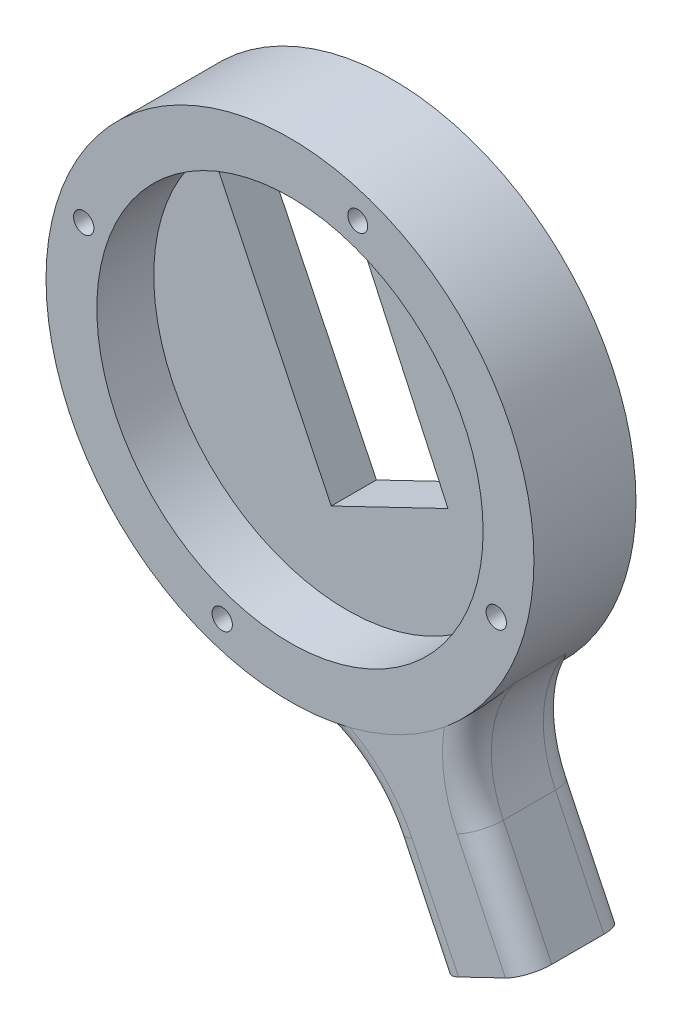
from build123d import *

# Parameters (mm, degrees)
SKETCH1_R                = 60
BOSS_EXTRUDE1_DEPTH      = 25.1
SKETCH3_R                = 47.5
CUT_EXTRUDE2_DEPTH       = 14
CUT_EXTRUDE5_DEPTH       = 89.487343728
CUT_EXTRUDE5_DEPTH_BACK  = 89.487343728
SKETCH2_R                = 2.494998654
SKETCH2_R_2              = 2.5
SKETCH2_R_3              = 2.444443829
SKETCH6_R                = 3
CUT_EXTRUDE6_DEPTH       = 6
CUT_EXTRUDE7_DEPTH       = 87
CUT_EXTRUDE7_DEPTH_BACK  = 87
BOSS_EXTRUDE2_DEPTH      = 30
BOSS_EXTRUDE2_DEPTH_BACK = 23
SKETCH8_W                = 24.8
SKETCH8_H                = 24.8
FILLET1_R                = 30
SKETCH9_R                = 6.1
CUT_EXTRUDE8_DEPTH       = 40
FILLET2_R                = 6


with BuildPart() as part:
    # Sketch1 → Boss-Extrude1 (new body)
    with BuildSketch(Plane.XY):
        Circle(SKETCH1_R)
    extrude(amount=BOSS_EXTRUDE1_DEPTH)

    # Sketch3 → Cut-Extrude2 (cut)
    with BuildSketch(Plane.XY.offset(25.1)):
        Circle(SKETCH3_R)
    extrude(amount=-CUT_EXTRUDE2_DEPTH, mode=Mode.SUBTRACT)

    # Sketch2 → Cut-Extrude5 (cut, two sides: drawn at the far end of the back side and taken through both)
    with BuildSketch(Plane.XY.offset(25.1).offset(-CUT_EXTRUDE5_DEPTH_BACK)):
        with Locations((-16.664697145, -50.733104448)):
            Circle(SKETCH2_R)
        with Locations((-50.733105114, 16.664696544)):
            Circle(SKETCH2_R_2)
        with Locations((16.664695878, 50.733104512)):
            Circle(SKETCH2_R_3)
        with Locations((50.733103846, -16.66469648)):
            Circle(SKETCH2_R_2)
    extrude(amount=CUT_EXTRUDE5_DEPTH + CUT_EXTRUDE5_DEPTH_BACK, mode=Mode.SUBTRACT)

    # Sketch6 → Cut-Extrude6 (cut)
    with BuildSketch(Plane(origin=(0, 0, 0), x_dir=(-1, 0, 0), z_dir=(0, 0, -1))):
        with Locations((11.973502988, 47.212610548)):
            Circle(SKETCH6_R)
        with Locations((27.381285989, 40.029281029)):
            Circle(SKETCH6_R)
        with Locations((-19.717656658, -20.762902692)):
            Circle(SKETCH6_R)
        with Locations((-4.309873657, -27.946232212)):
            Circle(SKETCH6_R)
    extrude(amount=-CUT_EXTRUDE6_DEPTH, mode=Mode.SUBTRACT)

    # Sketch7 → Cut-Extrude7 (cut, two sides: drawn at the far end of the back side and taken through both)
    with BuildSketch(Plane.XY.offset(11.1).offset(-CUT_EXTRUDE7_DEPTH_BACK)):
        Polygon((-32.722381774, 32.714358343), (-3.845549598, -27.273283804), (24.859322702, -13.455341469), (-3.0425496, 47.001626555), align=None)
    extrude(amount=CUT_EXTRUDE7_DEPTH + CUT_EXTRUDE7_DEPTH_BACK, mode=Mode.SUBTRACT)

    # Sketch8 → Boss-Extrude2 (add, two sides: drawn at the far end of the back side and taken through both)
    with BuildSketch(Plane(origin=(33.107502317, -68.776276749, 0), x_dir=(-0.9010375187182339, -0.43374115537044483, 0), z_dir=(0.43374115537044483, -0.9010375187182339, 0)).offset(-BOSS_EXTRUDE2_DEPTH_BACK)):
        with Locations((-0.981202476, -12.478185074)):
            Rectangle(SKETCH8_W, SKETCH8_H)
    extrude(amount=BOSS_EXTRUDE2_DEPTH + BOSS_EXTRUDE2_DEPTH_BACK)

    # Fillet1
    fillet1_edges = [part.edges().sort_by_distance(p)[0] for p in [
        (15.260065741, -58.026979876, 12.478185074),
        (37.425978865, -46.896653463, 12.478185074),
    ]]
    fillet(fillet1_edges, radius=FILLET1_R)

    # Sketch9 → Cut-Extrude8 (cut)
    with BuildSketch(Plane(origin=(46.119736978, -95.80740231, 0), x_dir=(0.9010375187182338, 0.4337411553704451, 0), z_dir=(0.43374115537044505, -0.9010375187182337, 0))):
        with Locations((0.981202476, 12.478185074)):
            Circle(SKETCH9_R)
    extrude(amount=-CUT_EXTRUDE8_DEPTH, mode=Mode.SUBTRACT)

    # Fillet2
    fillet2_edges = [part.edges().sort_by_distance(p)[0] for p in [
        (30.09970486, -88.854286544, 24.878185074),
        (13.674320118, -64.799081368, 24.878185074),
    ]]
    fillet(fillet2_edges, radius=FILLET2_R)
    fillet2_2_edges = [part.edges().sort_by_distance(p)[0] for p in [
        (52.218108704, -77.625266141, 24.878185074),
        (43.399669363, -49.679517659, 24.878185074),
    ]]
    fillet(fillet2_2_edges, radius=FILLET2_R)
    fillet2_3_edges = [part.edges().sort_by_distance(p)[0] for p in [
        (13.674320118, -64.799081368, 0.078185074),
        (30.09970486, -88.854286544, 0.078185074),
    ]]
    fillet(fillet2_3_edges, radius=FILLET2_R)
    fillet2_4_edges = [part.edges().sort_by_distance(p)[0] for p in [
        (52.218108704, -77.625266141, 0.078185074),
        (43.399669363, -49.679517659, 0.078185074),
    ]]
    fillet(fillet2_4_edges, radius=FILLET2_R)


solid = part.part
